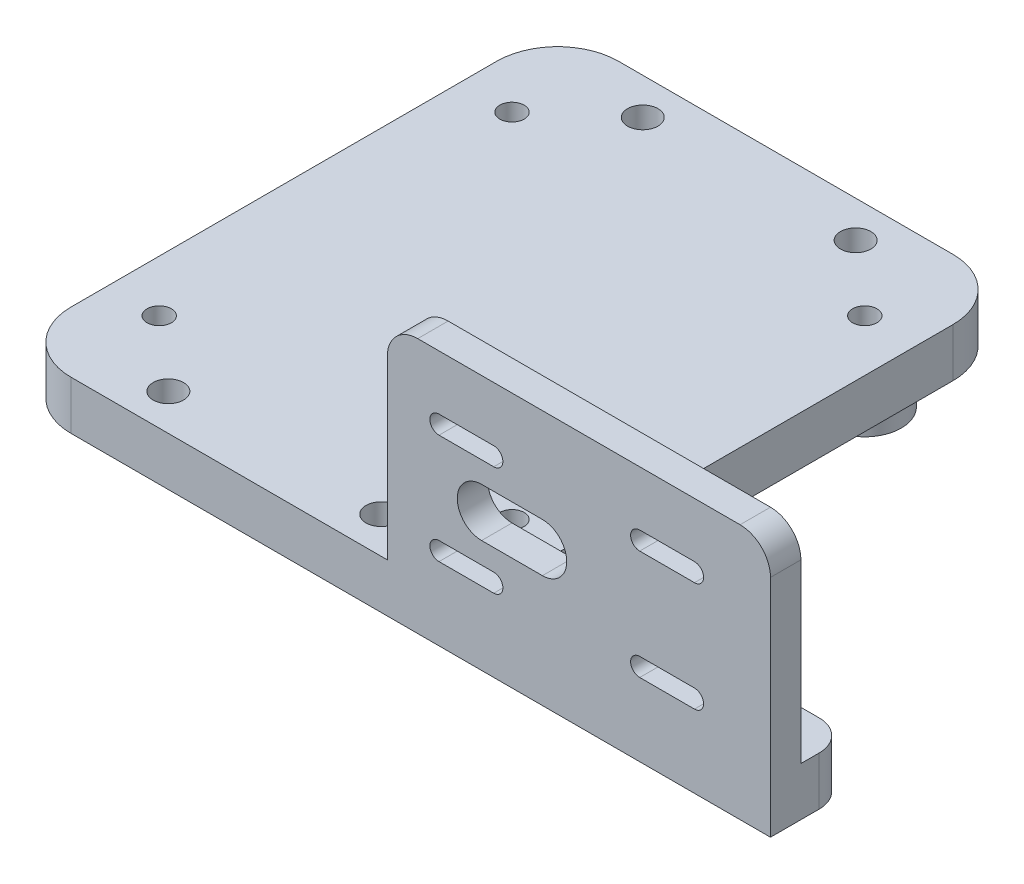
from build123d import *

# Parameters (mm, degrees)
BOSS_EXTRUDE1_DEPTH     = 8
SKETCH2_R               = 18
SKETCH2_R_2             = 15.5
BOSS_EXTRUDE2_DEPTH     = 5
CUT_EXTRUDE2_DEPTH      = 155.23683088
CUT_EXTRUDE2_DEPTH_BACK = 155.23683088
SKETCH3_R               = 2
FILLET2_R               = 10
FILLET3_R               = 10
FILLET4_R               = 10
CUT_EXTRUDE3_REACH      = 156.237
SKETCH5_R               = 2.5
SKETCH7_W               = 5
SKETCH7_H               = 34
BOSS_EXTRUDE3_DEPTH     = 63
FILLET5_R               = 5
FILLET6_R               = 5
FILLET7_R               = 5
CUT_EXTRUDE4_REACH      = 161.653
BOSS_EXTRUDE4_START     = 5
SKETCH13_R              = 6
SKETCH13_R_2            = 2
BOSS_EXTRUDE4_DEPTH     = 5


with BuildPart() as part:
    # Sketch1 → Boss-Extrude1 (new body)
    with BuildSketch(Plane(origin=(0, 0, 0), x_dir=(1, 0, 0), z_dir=(0, 1, 0))):
        Polygon((75, 0), (0, 0), (0, -90), (125, -90), (125, -77), (75, -77), align=None)
    extrude(amount=BOSS_EXTRUDE1_DEPTH)

    # Sketch2 → Boss-Extrude2 (add)
    with BuildSketch(Plane.XZ):
        with Locations((37.5, 45)):
            Circle(SKETCH2_R)
        with Locations((37.5, 45)):
            Circle(SKETCH2_R_2, mode=Mode.SUBTRACT)
    extrude(amount=BOSS_EXTRUDE2_DEPTH)

    # Sketch3 → Cut-Extrude2 (cut, two sides: drawn at the far end of the back side and taken through both)
    with BuildSketch(Plane.XZ.offset(-CUT_EXTRUDE2_DEPTH_BACK)):
        with Locations((8.5, 74)):
            Circle(SKETCH3_R)
        with Locations((66.5, 74)):
            Circle(SKETCH3_R)
        with Locations((8.5, 16)):
            Circle(SKETCH3_R)
        with Locations((66.5, 16)):
            Circle(SKETCH3_R)
    extrude(amount=CUT_EXTRUDE2_DEPTH + CUT_EXTRUDE2_DEPTH_BACK, mode=Mode.SUBTRACT)

    # Fillet2
    fillet2_edges = [part.edges().sort_by_distance(p)[0] for p in [
        (0, 4, 0),
    ]]
    fillet(fillet2_edges, radius=FILLET2_R)

    # Fillet3
    fillet3_edges = [part.edges().sort_by_distance(p)[0] for p in [
        (0, 4, 90),
    ]]
    fillet(fillet3_edges, radius=FILLET3_R)

    # Fillet4
    fillet4_edges = [part.edges().sort_by_distance(p)[0] for p in [
        (75, 4, 0),
    ]]
    fillet(fillet4_edges, radius=FILLET4_R)

    # Sketch5 → Cut-Extrude3 (cut, up to next)
    with BuildSketch(Plane.XZ, mode=Mode.PRIVATE) as cut_extrude3_sk1:
        with Locations((55, 84)):
            Circle(SKETCH5_R)
    cut_extrude3_tool1 = extrude(cut_extrude3_sk1.sketch, amount=-CUT_EXTRUDE3_REACH, mode=Mode.PRIVATE) & part.part
    # Sketch5 → Cut-Extrude3 (cut, up to next)
    with BuildSketch(Plane.XZ, mode=Mode.PRIVATE) as cut_extrude3_sk2:
        with Locations((20, 84)):
            Circle(SKETCH5_R)
    cut_extrude3_tool2 = extrude(cut_extrude3_sk2.sketch, amount=-CUT_EXTRUDE3_REACH, mode=Mode.PRIVATE) & part.part
    # Sketch5 → Cut-Extrude3 (cut, up to next)
    with BuildSketch(Plane.XZ, mode=Mode.PRIVATE) as cut_extrude3_sk3:
        with Locations((55, 6)):
            Circle(SKETCH5_R)
    cut_extrude3_tool3 = extrude(cut_extrude3_sk3.sketch, amount=-CUT_EXTRUDE3_REACH, mode=Mode.PRIVATE) & part.part
    # Sketch5 → Cut-Extrude3 (cut, up to next)
    with BuildSketch(Plane.XZ, mode=Mode.PRIVATE) as cut_extrude3_sk4:
        with Locations((20, 6)):
            Circle(SKETCH5_R)
    cut_extrude3_tool4 = extrude(cut_extrude3_sk4.sketch, amount=-CUT_EXTRUDE3_REACH, mode=Mode.PRIVATE) & part.part
    add(cut_extrude3_tool1.solids().sort_by_distance((55, 0, 84))[0], mode=Mode.SUBTRACT)
    add(cut_extrude3_tool2.solids().sort_by_distance((20, 0, 84))[0], mode=Mode.SUBTRACT)
    add(cut_extrude3_tool3.solids().sort_by_distance((55, 0, 6))[0], mode=Mode.SUBTRACT)
    add(cut_extrude3_tool4.solids().sort_by_distance((20, 0, 6))[0], mode=Mode.SUBTRACT)

    # Sketch7 → Boss-Extrude3 (add)
    with BuildSketch(Plane(origin=(125, 0, 0), x_dir=(0, 0, -1), z_dir=(1, 0, 0))):
        with Locations((-87.5, 25)):
            Rectangle(SKETCH7_W, SKETCH7_H)
    extrude(amount=-BOSS_EXTRUDE3_DEPTH)

    # Fillet5
    fillet5_edges = [part.edges().sort_by_distance(p)[0] for p in [
        (125, 42, 87.5),
    ]]
    fillet(fillet5_edges, radius=FILLET5_R)

    # Fillet6
    fillet6_edges = [part.edges().sort_by_distance(p)[0] for p in [
        (125, 4, 77),
    ]]
    fillet(fillet6_edges, radius=FILLET6_R)

    # Fillet7
    fillet7_edges = [part.edges().sort_by_distance(p)[0] for p in [
        (62, 42, 87.5),
    ]]
    fillet(fillet7_edges, radius=FILLET7_R)

    # Sketch12 → Cut-Extrude4 (cut, up to next)
    with BuildSketch(Plane.XY.offset(90), mode=Mode.PRIVATE) as cut_extrude4_sk1:
        with BuildLine():
            Line((77.5, 26.5), (87.5, 26.5))
            ThreePointArc((87.5, 26.5), (91.5, 22.5), (87.5, 18.5))
            Line((87.5, 18.5), (77.5, 18.5))
            ThreePointArc((77.5, 18.5), (73.5, 22.5), (77.5, 26.5))
        make_face()
    cut_extrude4_tool1 = extrude(cut_extrude4_sk1.sketch, amount=-CUT_EXTRUDE4_REACH, mode=Mode.PRIVATE) & part.part
    # Sketch12 → Cut-Extrude4 (cut, up to next)
    with BuildSketch(Plane.XY.offset(90), mode=Mode.PRIVATE) as cut_extrude4_sk2:
        with BuildLine():
            Line((70.5, 33), (79.5, 33))
            ThreePointArc((79.5, 33), (81, 31.5), (79.5, 30))
            Line((79.5, 30), (70.5, 30))
            ThreePointArc((70.5, 30), (69, 31.5), (70.5, 33))
        make_face()
    cut_extrude4_tool2 = extrude(cut_extrude4_sk2.sketch, amount=-CUT_EXTRUDE4_REACH, mode=Mode.PRIVATE) & part.part
    # Sketch12 → Cut-Extrude4 (cut, up to next)
    with BuildSketch(Plane.XY.offset(90), mode=Mode.PRIVATE) as cut_extrude4_sk3:
        with BuildLine():
            Line((70.5, 12), (79.5, 12))
            ThreePointArc((79.5, 12), (81, 13.5), (79.5, 15))
            Line((79.5, 15), (70.5, 15))
            ThreePointArc((70.5, 15), (69, 13.5), (70.5, 12))
        make_face()
    cut_extrude4_tool3 = extrude(cut_extrude4_sk3.sketch, amount=-CUT_EXTRUDE4_REACH, mode=Mode.PRIVATE) & part.part
    # Sketch12 → Cut-Extrude4 (cut, up to next)
    with BuildSketch(Plane.XY.offset(90), mode=Mode.PRIVATE) as cut_extrude4_sk4:
        with BuildLine():
            Line((103.5, 33), (112.5, 33))
            ThreePointArc((112.5, 33), (114, 31.5), (112.5, 30))
            Line((112.5, 30), (103.5, 30))
            ThreePointArc((103.5, 30), (102, 31.5), (103.5, 33))
        make_face()
    cut_extrude4_tool4 = extrude(cut_extrude4_sk4.sketch, amount=-CUT_EXTRUDE4_REACH, mode=Mode.PRIVATE) & part.part
    # Sketch12 → Cut-Extrude4 (cut, up to next)
    with BuildSketch(Plane.XY.offset(90), mode=Mode.PRIVATE) as cut_extrude4_sk5:
        with BuildLine():
            Line((103.5, 12), (112.5, 12))
            ThreePointArc((112.5, 12), (114, 13.5), (112.5, 15))
            Line((112.5, 15), (103.5, 15))
            ThreePointArc((103.5, 15), (102, 13.5), (103.5, 12))
        make_face()
    cut_extrude4_tool5 = extrude(cut_extrude4_sk5.sketch, amount=-CUT_EXTRUDE4_REACH, mode=Mode.PRIVATE) & part.part
    add(cut_extrude4_tool1.solids().sort_by_distance((82.5, 22.5, 90))[0], mode=Mode.SUBTRACT)
    add(cut_extrude4_tool2.solids().sort_by_distance((75, 31.5, 90))[0], mode=Mode.SUBTRACT)
    add(cut_extrude4_tool3.solids().sort_by_distance((75, 13.5, 90))[0], mode=Mode.SUBTRACT)
    add(cut_extrude4_tool4.solids().sort_by_distance((108, 31.5, 90))[0], mode=Mode.SUBTRACT)
    add(cut_extrude4_tool5.solids().sort_by_distance((108, 13.5, 90))[0], mode=Mode.SUBTRACT)

    # Sketch13 → Boss-Extrude4 (add)
    # profile 1 of 4: a face of its own
    with BuildSketch(Plane.XZ.offset(BOSS_EXTRUDE4_START)):
        with Locations((8.5, 74)):
            Circle(SKETCH13_R)
        with Locations((8.5, 74)):
            Circle(SKETCH13_R_2, mode=Mode.SUBTRACT)
    # profile 2 of 4: a face of its own
    with BuildSketch(Plane.XZ.offset(BOSS_EXTRUDE4_START)):
        with Locations((66.5, 74)):
            Circle(SKETCH13_R)
        with Locations((66.5, 74)):
            Circle(SKETCH13_R_2, mode=Mode.SUBTRACT)
    # profile 3 of 4: a face of its own
    with BuildSketch(Plane.XZ.offset(BOSS_EXTRUDE4_START)):
        with Locations((66.5, 16)):
            Circle(SKETCH13_R)
        with Locations((66.5, 16)):
            Circle(SKETCH13_R_2, mode=Mode.SUBTRACT)
    # profile 4 of 4: a face of its own
    with BuildSketch(Plane.XZ.offset(BOSS_EXTRUDE4_START)):
        with Locations((8.5, 16)):
            Circle(SKETCH13_R)
        with Locations((8.5, 16)):
            Circle(SKETCH13_R_2, mode=Mode.SUBTRACT)
    extrude(amount=-BOSS_EXTRUDE4_DEPTH)


solid = part.part
